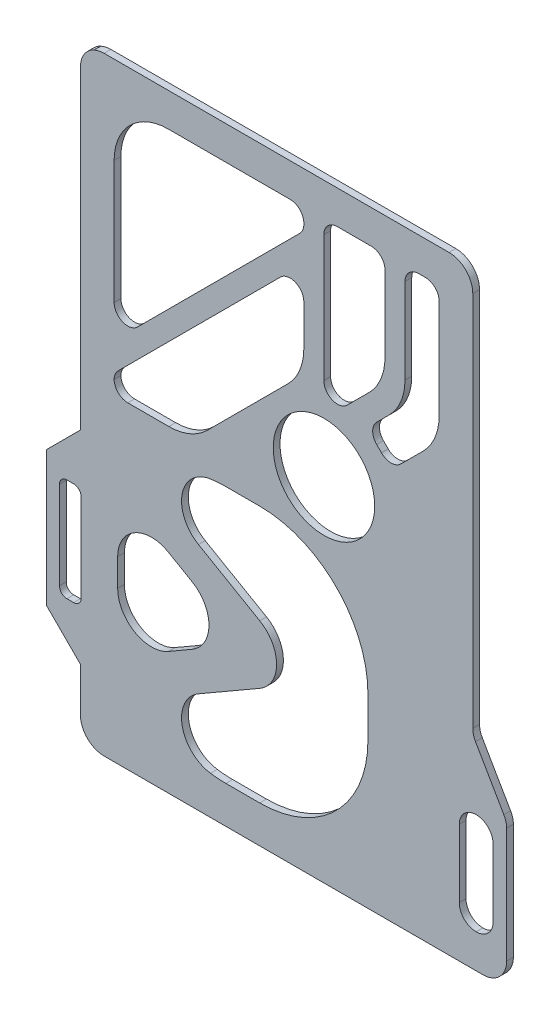
from build123d import *

# Parameters (mm, degrees)
SKETCH_1_R          = 7.5
EXTRUDE_1_DEPTH     = 1
FILLET_1_R          = 3
FILLET_2_R          = 3.5
CUT_EXTRUDE_1_DEPTH = 10
EXTRUDE_2_DEPTH     = 1
FILLET_3_R          = 5


with BuildPart() as part:
    # 草图1 → 凸台-拉伸1 (new body)
    with BuildSketch(Plane.XY):
        with BuildLine():
            ThreePointArc((-32.5, 37.977350269), (-33.269043009, 37.891244277), (-34, 37.637190605))
            Line((-34, 37.637190605), (-34, 37.66227766))
            ThreePointArc((-34, 37.66227766), (-35.458039892, 36.370828693), (-36, 34.5))
            Line((-36, 34.5), (-36, -12))
            Line((-36, -12), (-41, -17))
            Line((-41, -17), (-41, -37))
            Line((-41, -37), (-36, -42))
            Line((-36, -42), (-36, -48.5))
            ThreePointArc((-36, -48.5), (-34.974873734, -50.974873734), (-32.5, -52))
            Line((-32.5, -52), (-3, -52))
            Line((-3, -52), (27, -52))
            Line((27, -52), (27, -30.660254038))
            Line((27, -30.660254038), (22, -22))
            Line((22, -22), (22, -2))
            Line((22, -2), (22, 37.977350269))
            Line((22, 37.977350269), (-32.5, 37.977350269))
        make_face()
        with BuildLine():
            Line((-37, -34.6), (-38, -34.6))
            ThreePointArc((-38, -34.6), (-38.777817459, -34.277817459), (-39.1, -33.5))
            Line((-39.1, -33.5), (-39.1, -20.5))
            ThreePointArc((-39.1, -20.5), (-38.777817459, -19.722182541), (-38, -19.4))
            Line((-38, -19.4), (-37, -19.4))
            ThreePointArc((-37, -19.4), (-36.222182541, -19.722182541), (-35.9, -20.5))
            Line((-35.9, -20.5), (-35.9, -33.5))
            ThreePointArc((-35.9, -33.5), (-36.222182541, -34.277817459), (-37, -34.6))
        make_face(mode=Mode.SUBTRACT)
        with BuildLine():
            Line((-9.5, -46.5), (-14.5, -46.5))
            ThreePointArc((-14.5, -46.5), (-25.813708499, -41.813708499), (-30.5, -30.5))
            Line((-30.5, -30.5), (-30.5, -24.5))
            ThreePointArc((-30.5, -24.5), (-25.813708499, -13.186291501), (-14.5, -8.5))
            Line((-14.5, -8.5), (-9.5, -8.5))
            ThreePointArc((-9.5, -8.5), (1.813708499, -13.186291501), (6.5, -24.5))
            Line((6.5, -24.5), (6.5, -30.5))
            ThreePointArc((6.5, -30.5), (1.813708499, -41.813708499), (-9.5, -46.5))
        make_face(mode=Mode.SUBTRACT)
        with BuildLine():
            Line((-30.430229341, -1.640838471), (-6.430229341, 22.359161529))
            ThreePointArc((-6.430229341, 22.359161529), (-4.225965459, 22.797616876), (-2.977350269, 20.928932188))
            Line((-2.977350269, 20.928932188), (-2.977350269, 14.928932188))
            ThreePointArc((-2.977350269, 14.928932188), (-3.588038117, 11.858797052), (-5.327129972, 9.25606216))
            Line((-5.327129972, 9.25606216), (-17.25606216, -2.672870028))
            ThreePointArc((-17.25606216, -2.672870028), (-19.858797052, -4.411961883), (-22.928932188, -5.022649731))
            Line((-22.928932188, -5.022649731), (-29, -5.022649731))
            ThreePointArc((-29, -5.022649731), (-30.41761054, -4.442737776), (-31.022337577, -3.035533906))
            ThreePointArc((-31.022337577, -3.035533906), (-30.861813207, -2.280647977), (-30.430229341, -1.640838471))
        make_face(mode=Mode.SUBTRACT)
        with BuildLine():
            Line((-3.569770659, 29.398197784), (-27.569770659, 5.398197784))
            ThreePointArc((-27.569770659, 5.398197784), (-29.774034541, 4.959742437), (-31.022649731, 6.828427125))
            Line((-31.022649731, 6.828427125), (-31.022649731, 25))
            ThreePointArc((-31.022649731, 25), (-28.672870028, 30.672870028), (-23, 33.022649731))
            Line((-23, 33.022649731), (-5, 33.022649731))
            ThreePointArc((-5, 33.022649731), (-3.569770659, 32.430229341), (-2.977350269, 31))
            Line((-2.977350269, 31), (-2.977350269, 30.828427125))
            ThreePointArc((-2.977350269, 30.828427125), (-3.131315312, 30.054392583), (-3.569770659, 29.398197784))
        make_face(mode=Mode.SUBTRACT)
        Circle(SKETCH_1_R, mode=Mode.SUBTRACT)
        with BuildLine():
            Line((2, 33.022649731), (7, 33.022649731))
            ThreePointArc((7, 33.022649731), (8.430229341, 32.430229341), (9.022649731, 31))
            Line((9.022649731, 31), (9.022649731, 19.813708499))
            ThreePointArc((9.022649731, 19.813708499), (8.411961883, 16.743573363), (6.672870028, 14.140838471))
            Line((6.672870028, 14.140838471), (3.430229341, 10.898197784))
            ThreePointArc((3.430229341, 10.898197784), (1.225965459, 10.459742437), (-0.022649731, 12.328427125))
            Line((-0.022649731, 12.328427125), (-0.022649731, 31))
            ThreePointArc((-0.022649731, 31), (0.569770659, 32.430229341), (2, 33.022649731))
        make_face(mode=Mode.SUBTRACT)
        with BuildLine():
            Line((11.977350269, 18.384776311), (11.977350269, 31))
            ThreePointArc((11.977350269, 31), (12.569770659, 32.430229341), (14, 33.022649731))
            Line((14, 33.022649731), (15, 33.022649731))
            ThreePointArc((15, 33.022649731), (16.430229341, 32.430229341), (17.022649731, 31))
            Line((17.022649731, 31), (17.022649731, 16.313708499))
            ThreePointArc((17.022649731, 16.313708499), (16.411961883, 13.243573363), (14.672870028, 10.640838471))
            Line((14.672870028, 10.640838471), (11.359161529, 7.327129972))
            ThreePointArc((11.359161529, 7.327129972), (9.928932188, 6.734709582), (8.498702848, 7.327129972))
            Line((8.498702848, 7.327129972), (7.791596066, 8.034236753))
            ThreePointArc((7.791596066, 8.034236753), (7.199175676, 9.464466094), (7.791596066, 10.894695435))
            Line((7.791596066, 10.894695435), (9.640838471, 12.74393784))
            ThreePointArc((9.640838471, 12.74393784), (11.370110637, 15.331976529), (11.977350269, 18.384776311))
        make_face(mode=Mode.SUBTRACT)
    extrude(amount=EXTRUDE_1_DEPTH)

    # 圆角1
    fillet_1_edges = [part.edges().sort_by_distance(p)[0] for p in [
        (27, -30.660254038, 0.5),
        (22, -22, 0.5),
    ]]
    fillet(fillet_1_edges, radius=FILLET_1_R)

    # 圆角2
    fillet_2_edges = [part.edges().sort_by_distance(p)[0] for p in [
        (27, -52, 0.5),
        (22, 37.977350269, 0.5),
    ]]
    fillet(fillet_2_edges, radius=FILLET_2_R)

    # 草图2 → 切除-拉伸1 (cut)
    with BuildSketch(Plane(origin=(0, 0, 0), x_dir=(-1, 0, 0), z_dir=(0, 0, -1))):
        with BuildLine():
            Line((-22.51, -47), (-22.49, -47))
            ThreePointArc((-22.49, -47), (-20.729304115, -46.270695885), (-20, -44.51))
            Line((-20, -44.51), (-20, -34.49))
            ThreePointArc((-20, -34.49), (-20.729304115, -32.729304115), (-22.49, -32))
            Line((-22.49, -32), (-22.51, -32))
            ThreePointArc((-22.51, -32), (-24.270695885, -32.729304115), (-25, -34.49))
            Line((-25, -34.49), (-25, -44.51))
            ThreePointArc((-25, -44.51), (-24.270695885, -46.270695885), (-22.51, -47))
        make_face()
    extrude(amount=-CUT_EXTRUDE_1_DEPTH, mode=Mode.SUBTRACT)

    # 草图3 → 凸台-拉伸2 (add)
    with BuildSketch(Plane(origin=(0, 0, 0), x_dir=(-1, 0, 0), z_dir=(0, 0, -1))):
        with BuildLine():
            Line((12, -27.5), (29.320508076, -17.5))
            ThreePointArc((29.320508076, -17.5), (30.076804592, -18.942597605), (30.713203436, -20.441953728))
            Line((30.713203436, -20.441953728), (30.713203436, -10.922424267))
            Line((30.713203436, -10.922424267), (2, -27.5))
            Line((2, -27.5), (30.713203436, -44.077575733))
            Line((30.713203436, -44.077575733), (30.713203436, -34.558046272))
            ThreePointArc((30.713203436, -34.558046272), (30.076804592, -36.057402395), (29.320508076, -37.5))
            Line((29.320508076, -37.5), (12, -27.5))
        make_face()
    extrude(amount=-EXTRUDE_2_DEPTH)

    # 圆角3
    fillet_3_edges = [part.edges().sort_by_distance(p)[0] for p in [
        (-26.164686329, -41.451488157, 0.5),
        (-28.98117459, -37.304085721, 0.5),
        (-28.98117459, -17.695914279, 0.5),
        (-26.164686329, -13.548511843, 0.5),
        (-12, -27.5, 0.5),
        (-2, -27.5, 0.5),
    ]]
    fillet(fillet_3_edges, radius=FILLET_3_R)


solid = part.part
